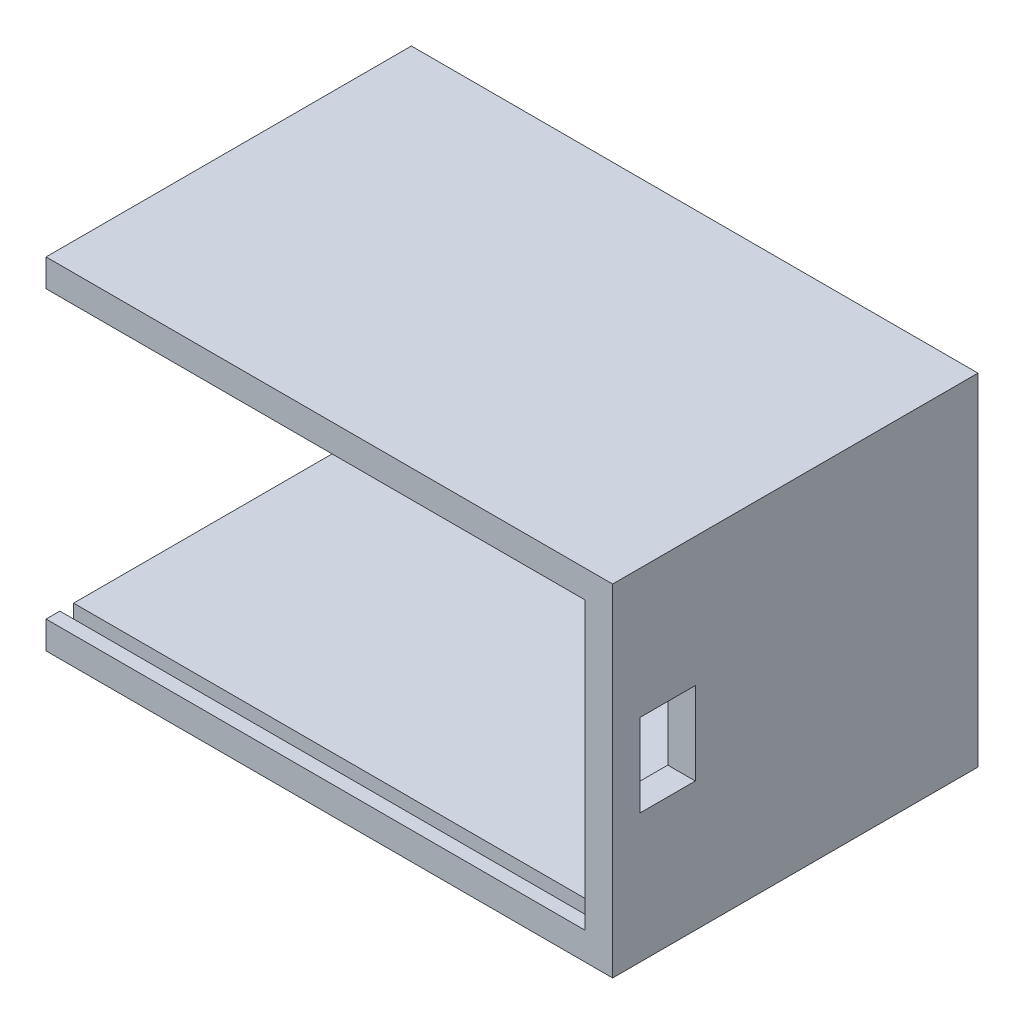
from build123d import *

# Parameters (mm, degrees)
ESQUISSE1_W              = 82.2
ESQUISSE1_H              = 49.5
BOSS_EXTRU_1_DEPTH       = 3
ESQUISSE2_W              = 82.2
ESQUISSE2_H              = 49.5
ESQUISSE2_W_2            = 74.2
ESQUISSE2_H_2            = 41.5
BOSS_EXTRU_2_DEPTH       = 50
ESQUISSE4_W              = 2
ESQUISSE4_H              = 41.5
ENL_V_MAT_EXTRU_3_DEPTH  = 16
ENL_V_MAT_EXTRU_4_DEPTH  = 80.2
ESQUISSE6_W              = 46
ESQUISSE6_H              = 41.5
ENL_V_MAT_EXTRU_5_DEPTH  = 10
ESQUISSE7_W              = 5
ESQUISSE7_H              = 9
BOSS_EXTRU_3_DEPTH       = 20
CHANFREIN1_SIZE          = 5
CHANFREIN2_SIZE          = 2
CHANFREIN3_SIZE          = 2
ESQUISSE8_R              = 6.75
ENL_V_MAT_EXTRU_6_DEPTH  = 5
ESQUISSE10_W             = 26.9
ESQUISSE10_H             = 17
BOSS_EXTRU_4_DEPTH       = 4.5
ESQUISSE9_W              = 33
ESQUISSE9_H              = 12.2
ENL_V_MAT_EXTRU_8_DEPTH  = 5
ESQUISSE11_W             = 2.2
ESQUISSE11_H             = 12.2
ENL_V_MAT_EXTRU_9_DEPTH  = 7
ESQUISSE12_W             = 18
ESQUISSE12_H             = 11
ENL_V_MAT_EXTRU_10_DEPTH = 2
ESQUISSE13_W             = 4.5
ESQUISSE13_H             = 11
ENL_V_MAT_EXTRU_11_DEPTH = 3
ESQUISSE14_W             = 4
ESQUISSE14_H             = 11
BOSS_EXTRU_5_DEPTH       = 3
ESQUISSE15_W             = 4
ESQUISSE15_H             = 11
ENL_V_MAT_EXTRU_12_DEPTH = 3
ESQUISSE16_W             = 7
ESQUISSE16_H             = 1.5
BOSS_EXTRU_6_DEPTH       = 3
CHANFREIN4_SIZE          = 3
ESQUISSE18_W             = 0.2
ESQUISSE18_H             = 1.5
ESQUISSE18_W_2           = 4.5
BOSS_EXTRU_8_DEPTH       = 3
ESQUISSE19_W             = 3
ESQUISSE19_H             = 1.25
BOSS_EXTRU_9_DEPTH       = 3
ESQUISSE20_W             = 1.7
ESQUISSE20_H             = 2
BOSS_EXTRU_10_DEPTH      = 11
CHANFREIN10_SIZE         = 3.247037966
CHANFREIN10_SIZE_2       = 5
CHANFREIN11_SIZE         = 2
ESQUISSE21_W             = 8
ESQUISSE21_H             = 12
ENL_V_MAT_EXTRU_13_DEPTH = 10


with BuildPart() as part:
    # Esquisse1 → Boss.-Extru.1 (new body)
    with BuildSketch(Plane.XY):
        Rectangle(ESQUISSE1_W, ESQUISSE1_H)
    extrude(amount=BOSS_EXTRU_1_DEPTH)

    # Esquisse2 → Boss.-Extru.2 (add)
    with BuildSketch(Plane.XY.offset(3)):
        Rectangle(ESQUISSE2_W, ESQUISSE2_H)
        Rectangle(ESQUISSE2_W_2, ESQUISSE2_H_2, mode=Mode.SUBTRACT)
    extrude(amount=BOSS_EXTRU_2_DEPTH)

    # Esquisse4 → Enlèv. mat.-Extru.3 (cut)
    with BuildSketch(Plane(origin=(-37.1, 0, 0), x_dir=(0, 0, -1), z_dir=(1, 0, 0))):
        with Locations((-52, 0)):
            Rectangle(ESQUISSE4_W, ESQUISSE4_H)
    extrude(amount=-ENL_V_MAT_EXTRU_3_DEPTH, mode=Mode.SUBTRACT)

    # Esquisse5 → Enlèv. mat.-Extru.4 (cut)
    with BuildSketch(Plane.ZY.offset(41.1)):
        Polygon((51, 22.75), (49, 22.75), (49, -22.75), (51, -22.75), (51, -20.75), (51, 20.75), align=None)
    extrude(amount=-ENL_V_MAT_EXTRU_4_DEPTH, mode=Mode.SUBTRACT)

    # Esquisse6 → Enlèv. mat.-Extru.5 (cut)
    with BuildSketch(Plane(origin=(-37.1, 0, 0), x_dir=(0, 0, -1), z_dir=(1, 0, 0))):
        with Locations((-26, 0)):
            Rectangle(ESQUISSE6_W, ESQUISSE6_H)
    extrude(amount=-ENL_V_MAT_EXTRU_5_DEPTH, mode=Mode.SUBTRACT)

    # Esquisse7 → Boss.-Extru.3 (add)
    with BuildSketch(Plane.ZY.offset(-37.1)):
        with Locations((15.5, 0)):
            Rectangle(ESQUISSE7_W, ESQUISSE7_H)
    extrude(amount=BOSS_EXTRU_3_DEPTH)

    # Chanfrein1
    chanfrein1_edges = [part.edges().sort_by_distance(p)[0] for p in [
        (37.1, 0, 18),
    ]]
    chamfer(chanfrein1_edges, length=CHANFREIN1_SIZE)

    # Chanfrein2
    chanfrein2_edges = [part.edges().sort_by_distance(p)[0] for p in [
        (37.1, 0, 13),
    ]]
    chamfer(chanfrein2_edges, length=CHANFREIN2_SIZE)

    # Chanfrein3
    chanfrein3_edges = [part.edges().sort_by_distance(p)[0] for p in [
        (37.1, -4.5, 17),
        (37.1, 4.5, 17),
    ]]
    chamfer(chanfrein3_edges, length=CHANFREIN3_SIZE)

    # Esquisse8 → Enlèv. mat.-Extru.6 (cut)
    with BuildSketch(Plane(origin=(0, 0, 0), x_dir=(-1, 0, 0), z_dir=(0, 0, -1))):
        with Locations((-23.6, 0)):
            Circle(ESQUISSE8_R)
    extrude(amount=-ENL_V_MAT_EXTRU_6_DEPTH, mode=Mode.SUBTRACT)

    # Esquisse10 → Boss.-Extru.4 (add)
    with BuildSketch(Plane.XY.offset(3)):
        with Locations((-7.45, 0)):
            Rectangle(ESQUISSE10_W, ESQUISSE10_H)
    extrude(amount=BOSS_EXTRU_4_DEPTH)

    # Esquisse9 → Enlèv. mat.-Extru.8 (cut)
    with BuildSketch(Plane(origin=(0, 0, 0), x_dir=(-1, 0, 0), z_dir=(0, 0, -1))):
        with Locations((12.9, 0)):
            Rectangle(ESQUISSE9_W, ESQUISSE9_H)
    extrude(amount=-ENL_V_MAT_EXTRU_8_DEPTH, mode=Mode.SUBTRACT)

    # Esquisse11 → Enlèv. mat.-Extru.9 (cut)
    with BuildSketch(Plane(origin=(-29.4, 0, 0), x_dir=(0, 0, -1), z_dir=(1, 0, 0))):
        with Locations((-1.9, 0)):
            Rectangle(ESQUISSE11_W, ESQUISSE11_H)
    extrude(amount=-ENL_V_MAT_EXTRU_9_DEPTH, mode=Mode.SUBTRACT)

    # Esquisse12 → Enlèv. mat.-Extru.10 (cut)
    with BuildSketch(Plane(origin=(0, 0, 0), x_dir=(-1, 0, 0), z_dir=(0, 0, -1))):
        with Locations((26.1, -15.25)):
            Rectangle(ESQUISSE12_W, ESQUISSE12_H)
    extrude(amount=-ENL_V_MAT_EXTRU_10_DEPTH, mode=Mode.SUBTRACT)

    # Esquisse13 → Enlèv. mat.-Extru.11 (cut)
    with BuildSketch(Plane(origin=(0, 0, 2), x_dir=(-1, 0, 0), z_dir=(0, 0, -1))):
        with Locations((21.85, -15.25)):
            Rectangle(ESQUISSE13_W, ESQUISSE13_H)
        with Locations((30.35, -15.25)):
            Rectangle(ESQUISSE13_W, ESQUISSE13_H)
    extrude(amount=-ENL_V_MAT_EXTRU_11_DEPTH, mode=Mode.SUBTRACT)

    # Esquisse14 → Boss.-Extru.5 (add)
    with BuildSketch(Plane.XY.offset(3)):
        with Locations((-26.1, -15.25)):
            Rectangle(ESQUISSE14_W, ESQUISSE14_H)
    extrude(amount=BOSS_EXTRU_5_DEPTH)

    # Esquisse15 → Enlèv. mat.-Extru.12 (cut)
    with BuildSketch(Plane(origin=(0, 0, 2), x_dir=(-1, 0, 0), z_dir=(0, 0, -1))):
        with Locations((26.1, -15.25)):
            Rectangle(ESQUISSE15_W, ESQUISSE15_H)
    extrude(amount=-ENL_V_MAT_EXTRU_12_DEPTH, mode=Mode.SUBTRACT)

    # Esquisse16 → Boss.-Extru.6 (add)
    with BuildSketch(Plane.XY.offset(3)):
        with Locations((-24.6, -9)):
            Rectangle(ESQUISSE16_W, ESQUISSE16_H)
    extrude(amount=BOSS_EXTRU_6_DEPTH)

    # Chanfrein4
    chanfrein4_edges = [part.edges().sort_by_distance(p)[0] for p in [
        (6, 0, 3),
    ]]
    chamfer(chanfrein4_edges, length=CHANFREIN4_SIZE)

    # Esquisse18 → Boss.-Extru.8 (add)
    with BuildSketch(Plane.XY.offset(3)):
        with Locations((-21, -9)):
            Rectangle(ESQUISSE18_W, ESQUISSE18_H)
        with Locations((-30.35, -9)):
            Rectangle(ESQUISSE18_W_2, ESQUISSE18_H)
    extrude(amount=BOSS_EXTRU_8_DEPTH)

    # Esquisse19 → Boss.-Extru.9 (add)
    with BuildSketch(Plane(origin=(-20.9, 0, 0), x_dir=(0, 0, -1), z_dir=(1, 0, 0))):
        with Locations((-4.5, -9.125)):
            Rectangle(ESQUISSE19_W, ESQUISSE19_H)
    extrude(amount=BOSS_EXTRU_9_DEPTH)

    # Esquisse20 → Boss.-Extru.10 (add)
    with BuildSketch(Plane(origin=(0, -9.75, 0), x_dir=(-1, 0, 0), z_dir=(0, -1, 0))):
        Polygon((17.9, -6), (24.1, -6), (24.1, -5), (19.6, -5), (17.9, -5), align=None)
        with Locations((18.75, -4)):
            Rectangle(ESQUISSE20_W, ESQUISSE20_H)
    extrude(amount=BOSS_EXTRU_10_DEPTH)

    # Chanfrein10
    # the kernel refuses this chamfer: 5, 3.247037966 mm, written as the material it adds along each edge
    with BuildSketch(Plane(origin=(-17.9, 4.422205001, 3), x_dir=(-0.04991856572298826, 0, 0.9987532912567346), z_dir=(0, -1, 0))) as chanfrein10_piece_1_section:
        Polygon((CHANFREIN10_SIZE * 0.998753291253, -CHANFREIN10_SIZE * 0.0499185657228), (-CHANFREIN10_SIZE_2 * 0.049918565723, -CHANFREIN10_SIZE_2 * 0.998753291257), (0, 0), align=None)
    chanfrein10_piece_1 = extrude(amount=25.172205001, mode=Mode.PRIVATE)
    chanfrein10_piece_1 = split(chanfrein10_piece_1, bisect_by=Plane(origin=(-17.932311405, -8.5, 6.135567439), z_dir=(0, 1, 0)), keep=Keep.TOP, mode=Mode.PRIVATE)
    chanfrein10_piece_1 = split(chanfrein10_piece_1, bisect_by=Plane(origin=(-17.932311405, -2.038897499, 6), z_dir=(0, 0, 1)), keep=Keep.TOP, mode=Mode.PRIVATE)
    add(chanfrein10_piece_1)
    with BuildSketch(Plane(origin=(-17.9, -8.5, 3), x_dir=(-0.04991856572298826, 0, 0.9987532912567346), z_dir=(0, -1, 0))) as chanfrein10_piece_2_section:
        Polygon((CHANFREIN10_SIZE * 0.998753291253, -CHANFREIN10_SIZE * 0.0499185657228), (-CHANFREIN10_SIZE_2 * 0.049918565723, -CHANFREIN10_SIZE_2 * 0.998753291257), (0, 0), align=None)
    chanfrein10_piece_2 = extrude(amount=12.25, mode=Mode.PRIVATE)
    chanfrein10_piece_2 = split(chanfrein10_piece_2, bisect_by=Plane(origin=(-16.206622299, -14.625, 6), z_dir=(0, 0, -1)), keep=Keep.TOP, mode=Mode.PRIVATE)
    add(chanfrein10_piece_2)

    # Chanfrein11
    chanfrein11_edges = [part.edges().sort_by_distance(p)[0] for p in [
        (-20.9, -8.25, 4.5),
    ]]
    chamfer(chanfrein11_edges, length=CHANFREIN11_SIZE)

    # Esquisse21 → Enlèv. mat.-Extru.13 (cut)
    with BuildSketch(Plane(origin=(41.1, 0, 0), x_dir=(0, 0, -1), z_dir=(1, 0, 0))):
        with Locations((-45, 0)):
            Rectangle(ESQUISSE21_W, ESQUISSE21_H)
    extrude(amount=-ENL_V_MAT_EXTRU_13_DEPTH, mode=Mode.SUBTRACT)


solid = part.part
